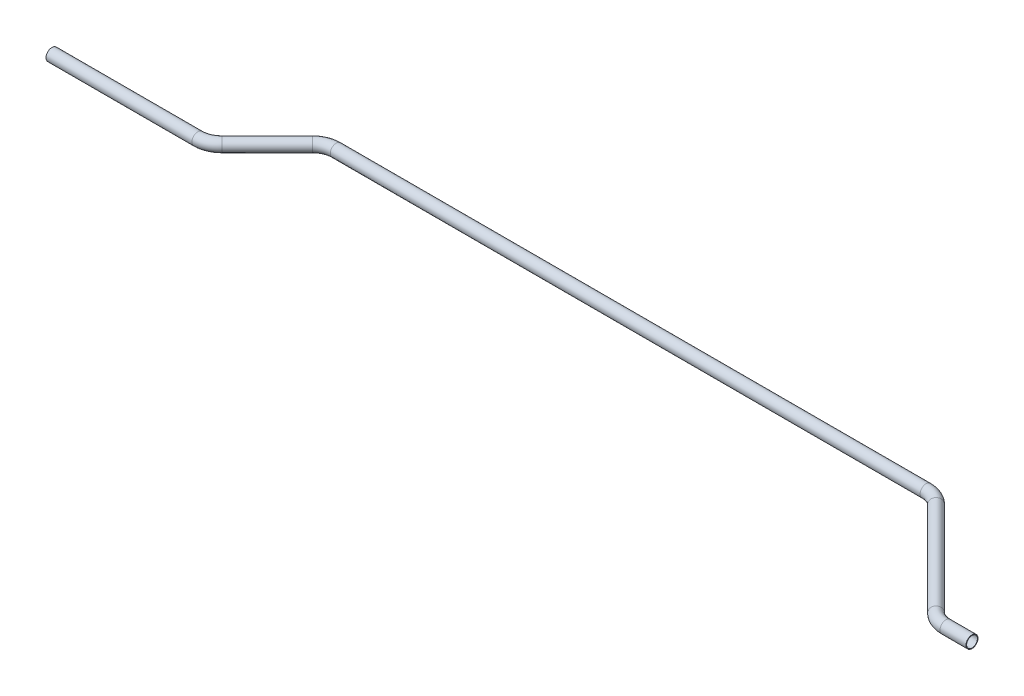
from build123d import *

# Parameters (mm, degrees)
SKETCH2_R   = 6.35
SKETCH2_R_2 = 5.715


with BuildPart() as part:
    # Sweep1: sweep along a path in Sketch1
    with BuildLine(Plane(origin=(0, 0, 0), x_dir=(1, 0, 0), z_dir=(0, 1, 0))) as sweep1_path:
        Line((0, 0), (154.578975516, 0))
        ThreePointArc((154.578975516, 0), (164.299134698, 1.933459874), (172.539487758, 7.439487758))
        Line((172.539487758, 7.439487758), (220.398512242, 55.298512242))
        ThreePointArc((220.398512242, 55.298512242), (228.638865302, 60.804540126), (238.359024484, 62.738))
        Line((238.359024484, 62.738), (863.086575516, 62.738))
        ThreePointArc((863.086575516, 62.738), (872.806734698, 60.804540126), (881.047087758, 55.298512242))
        Line((881.047087758, 55.298512242), (980.468112242, -44.122512242))
        ThreePointArc((980.468112242, -44.122512242), (988.708465302, -49.628540126), (998.428624484, -51.562))
        Line((998.428624484, -51.562), (1026.0076, -51.562))
    # Sketch2 → Sweep1 (sweep)
    with BuildSketch(Plane(origin=(0, 0, 0), x_dir=(0, 0, -1), z_dir=(1, 0, 0))):
        Circle(SKETCH2_R)
        Circle(SKETCH2_R_2, mode=Mode.SUBTRACT)
    sweep(path=sweep1_path.line)


solid = part.part
